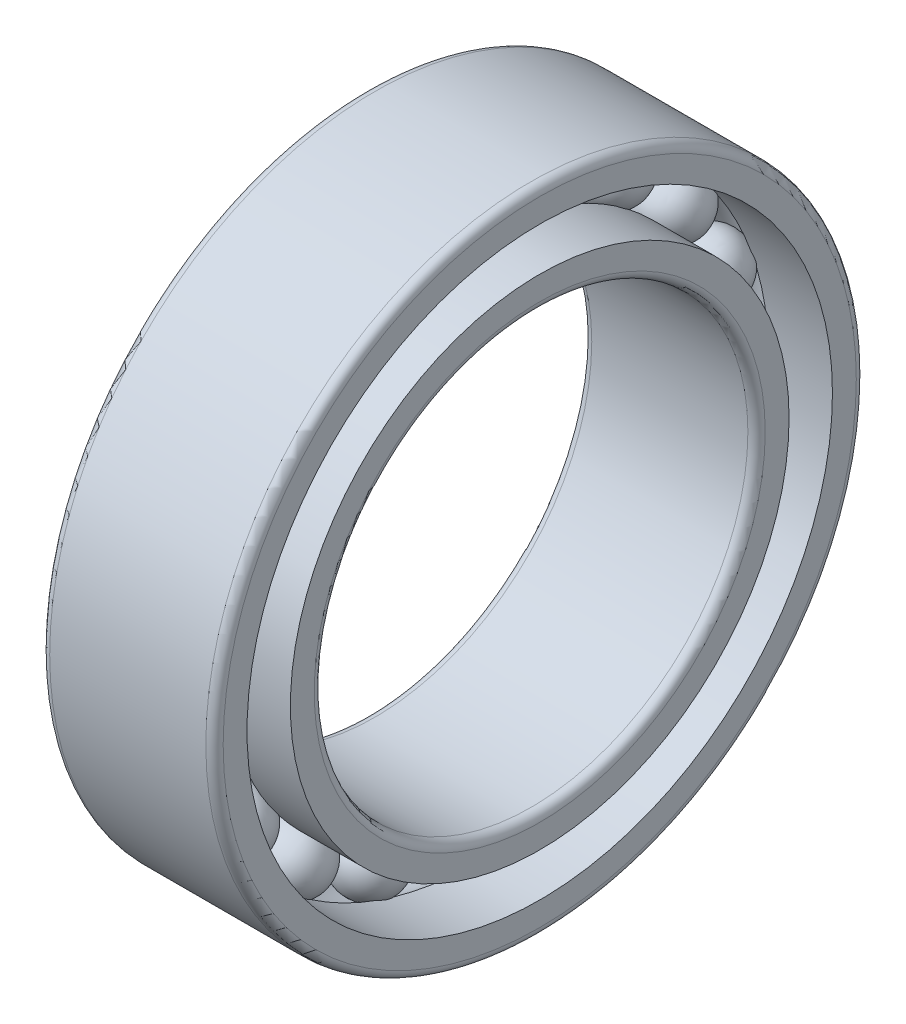
from build123d import *

# Parameters (mm, degrees)
CAGSPISKE_W         = 0.15
CAGSPISKE_H         = 0.25
CAGESPINE_ANGLE     = 0.001
BALLSDETAILED_COUNT = 20
BALLSDETAILED_ANGLE = 342


with BuildPart() as part:
    # CagSpiSke → CageSpine (revolve)
    with BuildSketch(Plane.XY):
        with Locations((0, 6.25)):
            Rectangle(CAGSPISKE_W, CAGSPISKE_H)
    revolve(axis=Axis((-20.6375, 0, 0), (-1, 0, 0)), revolution_arc=CAGESPINE_ANGLE)

    # BalDetSke → BallDetailed (revolve)
    with BuildSketch(Plane.XY):
        with BuildLine():
            Line((-0.75, 6.25), (0.75, 6.25))
            ThreePointArc((0.75, 6.25), (0, 5.5), (-0.75, 6.25))
        make_face()
    balldetailed = revolve(axis=Axis((-1.905, 6.25, 0), (1, 0, 0)))

    # InnRacSke → InnerRace (revolve)
    with BuildSketch(Plane.XY):
        with BuildLine():
            Line((-0.525, 5.75), (-2, 5.75))
            Line((-2, 5.75), (-2, 5.2))
            ThreePointArc((-2, 5.2), (-1.941421356, 5.058578644), (-1.8, 5))
            Line((-1.8, 5), (1.8, 5))
            ThreePointArc((1.8, 5), (1.941421356, 5.058578644), (2, 5.2))
            Line((2, 5.2), (2, 5.75))
            Line((2, 5.75), (0.525, 5.75))
            ThreePointArc((0.525, 5.75), (0, 5.525), (-0.525, 5.75))
        make_face()
    revolve(axis=Axis((-20.6375, 0, 0), (1, 0, 0)))

    # OutRacSke → OuterRace (revolve)
    with BuildSketch(Plane.XY):
        with BuildLine():
            Line((-0.525, 6.75), (-2, 6.75))
            Line((-2, 6.75), (-2, 7.3))
            ThreePointArc((-2, 7.3), (-1.941421356, 7.441421356), (-1.8, 7.5))
            Line((-1.8, 7.5), (1.8, 7.5))
            ThreePointArc((1.8, 7.5), (1.941421356, 7.441421356), (2, 7.3))
            Line((2, 7.3), (2, 6.75))
            Line((2, 6.75), (0.525, 6.75))
            ThreePointArc((0.525, 6.75), (0, 6.975), (-0.525, 6.75))
        make_face()
    revolve(axis=Axis((-20.6375, 0, 0), (1, 0, 0)))

    # BallsDetailed: BallDetailed ×20 about axis
    ballsdetailed_axis = Axis((-50, 0, 0), (1, 0, 0))
    for i in range(1, BALLSDETAILED_COUNT):
        add(balldetailed.rotate(ballsdetailed_axis, i * BALLSDETAILED_ANGLE / (BALLSDETAILED_COUNT - 1)))


solid = part.part
